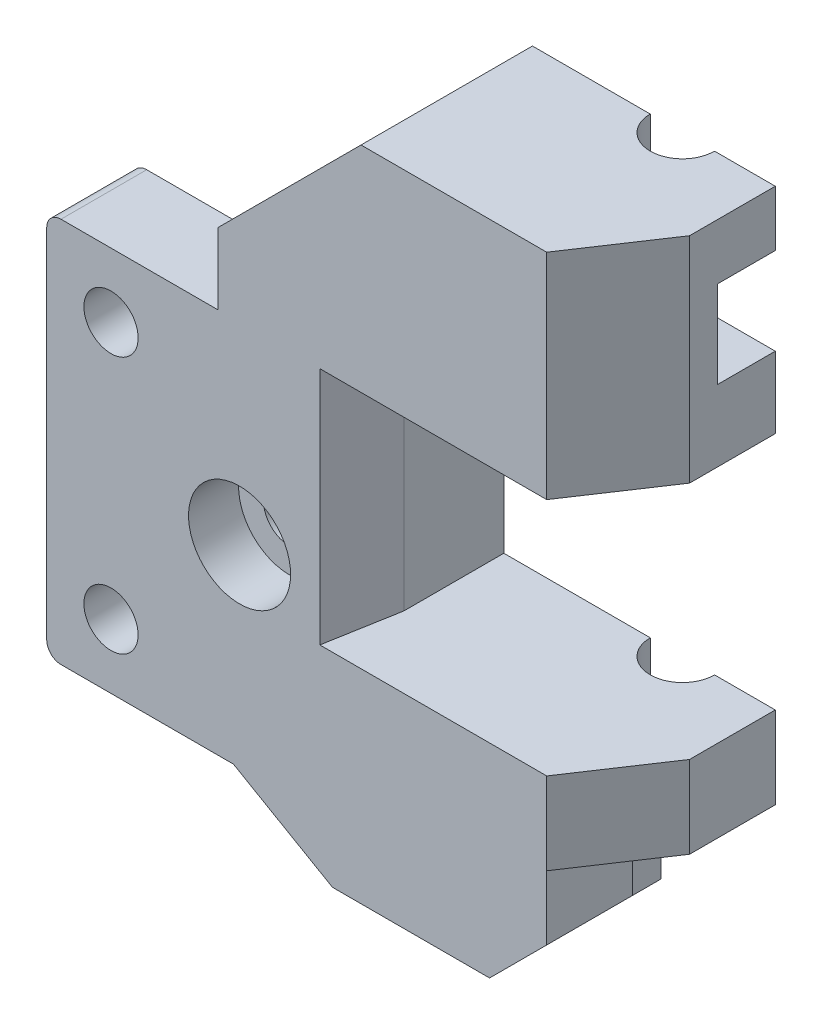
from build123d import *

# Parameters (mm, degrees)
BOSS_EXTRUDE1_DEPTH                            = 6
BOSS_EXTRUDE3_DEPTH                            = 6
CBORE_FOR_6_SOCKET_HEAD_CAP_SCREW1_D           = 3.6576
CBORE_FOR_6_SOCKET_HEAD_CAP_SCREW1_CBORE_D     = 7.14502
CBORE_FOR_6_SOCKET_HEAD_CAP_SCREW1_CBORE_DEPTH = 3.5052
F_6_CLEARANCE_HOLE1_D                          = 3.7973
F_6_CLEARANCE_HOLE1_DEPTH                      = 17.47
F_6_CLEARANCE_HOLE1_TIP                        = 1.140824014
BOSS_EXTRUDE5_DEPTH                            = 15
BOSS_EXTRUDE6_DEPTH                            = 5.75
CUT_EXTRUDE1_START                             = -20
SKETCH11_5_R                                   = 2.25
CUT_EXTRUDE1_DEPTH                             = 35
CUT_EXTRUDE2_DEPTH                             = 6.1
CHAMFER2_SIZE                                  = 10
SKETCH26_R                                     = 2
BOSS_EXTRUDE10_DEPTH                           = 2
CHAMFER3_SIZE                                  = 5
CHAMFER3_SIZE2                                 = 0.881634904
BOSS_EXTRUDE7_DEPTH                            = 6
BOSS_EXTRUDE9_DEPTH                            = 6


with BuildPart() as part:
    # Sketch2 → Boss-Extrude1 (new body)
    with BuildSketch(Plane.XY):
        with BuildLine():
            Line((1, 0), (20, 0))
            Line((20, 0), (20, 27))
            Line((20, 27), (1, 27))
            ThreePointArc((1, 27), (0.292893219, 26.707106781), (0, 26))
            Line((0, 26), (0, 1))
            ThreePointArc((0, 1), (0.292893219, 0.292893219), (1, 0))
        make_face()
    extrude(amount=BOSS_EXTRUDE1_DEPTH)

    # Sketch3 → Boss-Extrude3 (add)
    with BuildSketch(Plane.XY):
        with BuildLine():
            ThreePointArc((0, 10.5), (6.616034902, 11.695303767), (11.531693039, 7.108695652))
            ThreePointArc((11.531693039, 7.108695652), (12.997768364, 5.216311724), (15.281929326, 4.5))
            Line((15.281929326, 4.5), (20, 4.5))
            Line((20, 4.5), (20, 27))
            Line((20, 27), (12, 27))
            Line((12, 27), (12, 22.5))
            ThreePointArc((12, 22.5), (7.854101966, 15.791796068), (0, 16.5))
            Line((0, 16.5), (0, 10.5))
        make_face()
    extrude(amount=-BOSS_EXTRUDE3_DEPTH)

    # CBORE for #6 Socket Head Cap Screw1 (through all)
    with Locations(Plane.XY.offset(6)):
        with Locations((13.5, 13.5)):
            CounterBoreHole(CBORE_FOR_6_SOCKET_HEAD_CAP_SCREW1_D / 2, CBORE_FOR_6_SOCKET_HEAD_CAP_SCREW1_CBORE_D / 2, CBORE_FOR_6_SOCKET_HEAD_CAP_SCREW1_CBORE_DEPTH)

    # #6 Clearance Hole1
    with Locations(Plane(origin=(0, 0, 0), x_dir=(-1, 0, 0), z_dir=(0, 0, -1))):
        with Locations((-4.5, 22.5), (-4.5, 4.5)):
            Hole(F_6_CLEARANCE_HOLE1_D / 2, depth=F_6_CLEARANCE_HOLE1_DEPTH)
            with Locations((0, 0, -(F_6_CLEARANCE_HOLE1_DEPTH + F_6_CLEARANCE_HOLE1_TIP / 2))):  # 118° drill point
                Cone(0, F_6_CLEARANCE_HOLE1_D / 2, F_6_CLEARANCE_HOLE1_TIP, mode=Mode.SUBTRACT)

    # Sketch11 → Boss-Extrude5 (add)
    with BuildSketch(Plane(origin=(0, 27, 0), x_dir=(1, 0, 0), z_dir=(0, 1, 0))):
        Polygon((12, 6), (12, -6), (35, -6), (39, 0), (39, 6), align=None)
    extrude(amount=BOSS_EXTRUDE5_DEPTH)

    # Sketch13 → Boss-Extrude6 (add)
    with BuildSketch(Plane(origin=(0, 10.25, 0), x_dir=(-1, 0, 0), z_dir=(0, -1, 0))):
        Polygon((-20, 6), (-39, 6), (-39, 0), (-35, -6), (-20, -6), align=None)
    extrude(amount=BOSS_EXTRUDE6_DEPTH)

    # Sketch11<5> → Cut-Extrude1 (cut)
    with BuildSketch(Plane(origin=(0, 27, 0), x_dir=(1, 0, 0), z_dir=(0, 1, 0)).offset(CUT_EXTRUDE1_START)):
        with Locations((32.5, 6)):
            Circle(SKETCH11_5_R)
    extrude(amount=CUT_EXTRUDE1_DEPTH, mode=Mode.SUBTRACT)

    # Sketch14 → Cut-Extrude2 (cut)
    with BuildSketch(Plane(origin=(0, 32, 0), x_dir=(-1, 0, 0), z_dir=(0, -1, 0))):
        with BuildLine():
            Line((-29.85, 12.55), (-29.85, -0.55))
            Line((-29.85, -0.55), (-28.547785431, -0.55))
            ThreePointArc((-28.547785431, -0.55), (-25.8382832, 2.239145141), (-24.85, 6))
            ThreePointArc((-24.85, 6), (-25.8382832, 9.760854859), (-28.547785431, 12.55))
            Line((-28.547785431, 12.55), (-29.85, 12.55))
        make_face()
        with BuildLine():
            Line((-28.547785431, -0.55), (-29.85, -0.55))
            Line((-29.85, -0.55), (-29.85, 12.55))
            Line((-29.85, 12.55), (-28.547785431, 12.55))
            ThreePointArc((-28.547785431, 12.55), (-40.15, 6), (-28.547785431, -0.55))
        make_face()
        with BuildLine():
            ThreePointArc((-24.85, 6), (-25.8382832, 2.239145141), (-28.547785431, -0.55))
            Line((-28.547785431, -0.55), (-24.85, -0.55))
            Line((-24.85, -0.55), (-24.85, 6))
        make_face()
        Polygon((-24.85, 6), (-24.85, -0.55), (-9.85, -0.55), (-9.85, 12.55), (-24.85, 12.55), align=None)
        with BuildLine():
            Line((-24.85, 12.55), (-28.547785431, 12.55))
            ThreePointArc((-28.547785431, 12.55), (-25.8382832, 9.760854859), (-24.85, 6))
            Line((-24.85, 6), (-24.85, 12.55))
        make_face()
    extrude(amount=-CUT_EXTRUDE2_DEPTH, mode=Mode.SUBTRACT)

    # Chamfer2
    chamfer2_edges = [part.edges().sort_by_distance(p)[0] for p in [
        (12, 42, 0),
    ]]
    chamfer(chamfer2_edges, length=CHAMFER2_SIZE)

    # Sketch26 → Boss-Extrude10 (add)
    with BuildSketch(Plane(origin=(0, 0, -6), x_dir=(-1, 0, 0), z_dir=(0, 0, -1))):
        with Locations((-16, 26)):
            Circle(SKETCH26_R)
    extrude(amount=BOSS_EXTRUDE10_DEPTH)

    # Chamfer3
    chamfer3_edges = [part.edges().sort_by_distance(p)[0] for p in [
        (20, 18.625, 6),
    ]]
    chamfer3_side = [part.faces().sort_by_distance(p)[0] for p in [
        (20, 18.625, 0),
    ]]
    chamfer(chamfer3_edges, length=CHAMFER3_SIZE, length2=CHAMFER3_SIZE2, reference=chamfer3_side[0])

    # Sketch15 → Boss-Extrude7 (add)
    with BuildSketch(Plane.XY.offset(6)):
        Polygon((20, 4.5), (20, 0), (13.07179677, 0), (20, -4), (31, -4), (35, 0), (35, 4.5), align=None)
    extrude(amount=-BOSS_EXTRUDE7_DEPTH)

    # Sketch17 → Boss-Extrude9 (add)
    with BuildSketch(Plane(origin=(0, 0, 0), x_dir=(-1, 0, 0), z_dir=(0, 0, -1))):
        with BuildLine():
            Line((-30.25, 0), (-15.870834875, 0))
            ThreePointArc((-15.870834875, 0), (-15.146390506, -0.555885716), (-15.495834875, -1.399519053))
            Line((-15.495834875, -1.399519053), (-20, -4))
            Line((-20, -4), (-31, -4))
            Line((-31, -4), (-31, -0.75))
            ThreePointArc((-31, -0.75), (-30.780330086, -0.219669914), (-30.25, 0))
        make_face()
    extrude(amount=BOSS_EXTRUDE9_DEPTH)


solid = part.part
